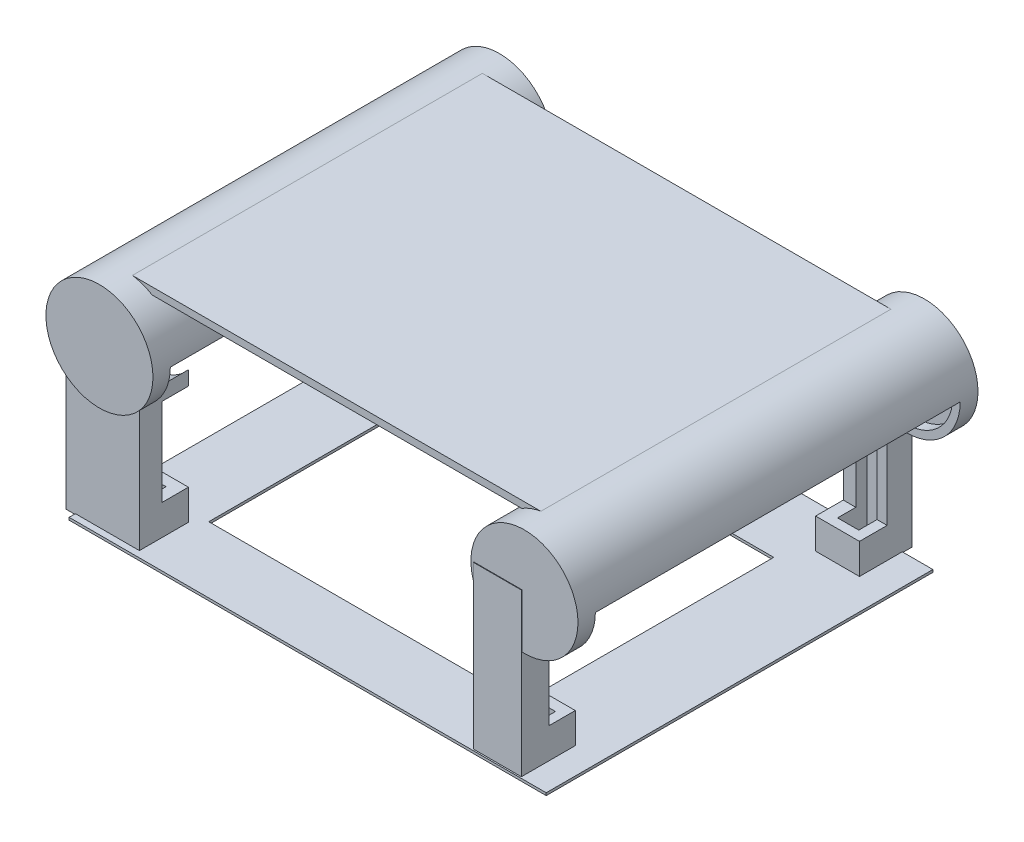
from build123d import *

# Parameters (mm, degrees)
MOTORHOLDERS_DEPTH            = 80
MOTORHOLDERS_DEPTH_BACK       = 80
MOTORHOLDERSSKETCH_R          = 21.41
MOTORHOLDERS_2_DEPTH          = 80
MOTORHOLDERS_2_DEPTH_BACK     = 80
BOSS_EXTRUDE2_DEPTH           = 70
BOSS_EXTRUDE2_DEPTH_BACK      = 70
SKETCH3_W                     = 166.402948119
SKETCH3_H                     = 2.817422897
SKETCH4_W                     = 262.774983374
SKETCH4_H                     = 145.919891702
CUT_EXTRUDE1_DEPTH            = 23
POWERBANKHOLDERS_DEPTH        = 30
POWERBANKHOLDERS_DEPTH_BACK   = 35
SKETCH6_W                     = 31.079303629
SKETCH6_H                     = 22.639087533
SKETCH6_W_2                   = 22.69689808
SKETCH6_H_2                   = 11.734008709
POWERBANKHOLDERS_2_DEPTH      = 30
POWERBANKHOLDERS_2_DEPTH_BACK = 35
SKETCH6_W_3                   = 29.43379696
SKETCH6_H_3                   = 19.610970688
SKETCH6_W_4                   = 20.089976669
SKETCH6_H_4                   = 9.83070569
POWERBANKHOLDERS_3_DEPTH      = 30
POWERBANKHOLDERS_3_DEPTH_BACK = 35
SKETCH6_W_5                   = 17.542642612
SKETCH6_H_5                   = 21.099390751
SKETCH6_W_6                   = 8.482440028
POWERBANKHOLDERS_4_DEPTH      = 30
POWERBANKHOLDERS_4_DEPTH_BACK = 35
SKETCH6_W_7                   = 19.167029737
SKETCH6_H_6                   = 21.547747601
SKETCH6_W_8                   = 10.64703133
SKETCH7_W                     = 190.824703485
SKETCH7_H                     = 154.667210728
SKETCH7_W_2                   = 125.335149465
SKETCH7_H_2                   = 100.638457321
TOPCELLPHONECOVER_DEPTH       = 1
POWERBANKEXTRUDE_DEPTH        = 17.5
POWERBANKEXTRUDE_DEPTH_BACK   = 17.5
SKETCH9_W                     = 243.146360692
SKETCH9_H                     = 137
MOTORHOLDEREXTRUDE_DEPTH      = 77
MOTORHOLDEREXTRUDE_DEPTH_BACK = 77
MOTORHOLDEREXTRUDESKETCH_R    = 18.415


with BuildPart() as part:
    # MotorHoldersSketch → MotorHolders (new, two sides: drawn at the far end of the back side and taken through both)
    with BuildSketch(Plane.XY.offset(-MOTORHOLDERS_DEPTH_BACK)):
        Circle(MOTORHOLDERSSKETCH_R)
    extrude(amount=MOTORHOLDERS_DEPTH + MOTORHOLDERS_DEPTH_BACK)


with BuildPart() as body_2:
    # MotorHoldersSketch → MotorHolders 2 (new, two sides: drawn at the far end of the back side and taken through both)
    with BuildSketch(Plane.XY.offset(-MOTORHOLDERS_2_DEPTH_BACK)):
        with Locations((170, 0)):
            Circle(MOTORHOLDERSSKETCH_R)
    extrude(amount=MOTORHOLDERS_2_DEPTH + MOTORHOLDERS_2_DEPTH_BACK)

    # Sketch3 → Boss-Extrude2 (add, two sides: drawn at the far end of the back side and taken through both)
    with BuildSketch(Plane.XY.offset(-BOSS_EXTRUDE2_DEPTH_BACK)):
        with Locations((85.14207121, 19.724241304)):
            Rectangle(SKETCH3_W, SKETCH3_H)
    extrude(amount=BOSS_EXTRUDE2_DEPTH + BOSS_EXTRUDE2_DEPTH_BACK)


with BuildPart() as cut_extrude1_tool:
    # Sketch4 → Cut-Extrude1 (new body)
    with BuildSketch(Plane(origin=(0, 0, 0), x_dir=(1, 0, 0), z_dir=(0, 1, 0))):
        with Locations((89.893628689, -0.090874356)):
            Rectangle(SKETCH4_W, SKETCH4_H)
    extrude(amount=-CUT_EXTRUDE1_DEPTH)


with BuildPart() as part_1:
    add(part.part)

    # Cut-Extrude1: cut by cut_extrude1_tool
    add(cut_extrude1_tool.part, mode=Mode.SUBTRACT)


with BuildPart() as body_2_1:
    add(body_2.part)

    # Cut-Extrude1: cut by cut_extrude1_tool
    add(cut_extrude1_tool.part, mode=Mode.SUBTRACT)


with BuildPart() as body_3:
    # Sketch6 → PowerBankHolders (new, two sides: drawn at the far end of the back side and taken through both)
    with BuildSketch(Plane(origin=(170, -34.829272125, 0), x_dir=(-1, 0, 0), z_dir=(0, -1, 0)).offset(-POWERBANKHOLDERS_DEPTH_BACK)):
        with Locations((170.111379473, 67.629448186)):
            Rectangle(SKETCH6_W, SKETCH6_H)
        with Locations((169.118096408, 66.379140187)):
            Rectangle(SKETCH6_W_2, SKETCH6_H_2, mode=Mode.SUBTRACT)
    extrude(amount=POWERBANKHOLDERS_DEPTH + POWERBANKHOLDERS_DEPTH_BACK)



with BuildPart() as body_4:
    # Sketch6 → PowerBankHolders 2 (new, two sides: drawn at the far end of the back side and taken through both)
    with BuildSketch(Plane(origin=(170, -34.829272125, 0), x_dir=(-1, 0, 0), z_dir=(0, -1, 0)).offset(-POWERBANKHOLDERS_2_DEPTH_BACK)):
        with Locations((170.443627243, -68.476666678)):
            Rectangle(SKETCH6_W_3, SKETCH6_H_3)
        with Locations((170.421557114, -67.894738702)):
            Rectangle(SKETCH6_W_4, SKETCH6_H_4, mode=Mode.SUBTRACT)
    extrude(amount=POWERBANKHOLDERS_2_DEPTH + POWERBANKHOLDERS_2_DEPTH_BACK)


with BuildPart() as body_5:
    # Sketch6 → PowerBankHolders 3 (new, two sides: drawn at the far end of the back side and taken through both)
    with BuildSketch(Plane(origin=(170, -34.829272125, 0), x_dir=(-1, 0, 0), z_dir=(0, -1, 0)).offset(-POWERBANKHOLDERS_3_DEPTH_BACK)):
        with Locations((11.52721305, 67.312978676)):
            Rectangle(SKETCH6_W_5, SKETCH6_H_5)
        with Locations((11.033379358, 66.379140187)):
            Rectangle(SKETCH6_W_6, SKETCH6_H_2, mode=Mode.SUBTRACT)
    extrude(amount=POWERBANKHOLDERS_3_DEPTH + POWERBANKHOLDERS_3_DEPTH_BACK)


with BuildPart() as body_6:
    # Sketch6 → PowerBankHolders 4 (new, two sides: drawn at the far end of the back side and taken through both)
    with BuildSketch(Plane(origin=(170, -34.829272125, 0), x_dir=(-1, 0, 0), z_dir=(0, -1, 0)).offset(-POWERBANKHOLDERS_4_DEPTH_BACK)):
        with Locations((10.584217292, -69.445055135)):
            Rectangle(SKETCH6_W_7, SKETCH6_H_6)
        with Locations((9.951083707, -67.894738702)):
            Rectangle(SKETCH6_W_8, SKETCH6_H_4, mode=Mode.SUBTRACT)
    extrude(amount=POWERBANKHOLDERS_4_DEPTH + POWERBANKHOLDERS_4_DEPTH_BACK)


with BuildPart() as body_3_1:
    add(body_3.part)

    add(body_4.part)  # TopCellPhoneCover merges body 4

    add(body_5.part)  # TopCellPhoneCover merges body 5

    add(body_6.part)  # TopCellPhoneCover merges body 6
    # Sketch7 → TopCellPhoneCover (add)
    with BuildSketch(Plane(origin=(170, -64.5, 0), x_dir=(-1, 0, 0), z_dir=(0, -1, 0))):
        with Locations((85.907620295, -3.467393964)):
            Rectangle(SKETCH7_W, SKETCH7_H)
        with Locations((89.203645692, -4.077931617)):
            Rectangle(SKETCH7_W_2, SKETCH7_H_2, mode=Mode.SUBTRACT)
    extrude(amount=TOPCELLPHONECOVER_DEPTH)

    # Sketch9 → PowerBankExtrude (cut, two sides: drawn at the far end of the back side and taken through both)
    with BuildSketch(Plane(origin=(170, -34.829272125, 0), x_dir=(-1, 0, 0), z_dir=(0, -1, 0)).offset(-POWERBANKEXTRUDE_DEPTH_BACK)):
        with Locations((61.591374201, -0.682586328)):
            Rectangle(SKETCH9_W, SKETCH9_H)
    extrude(amount=POWERBANKEXTRUDE_DEPTH + POWERBANKEXTRUDE_DEPTH_BACK, mode=Mode.SUBTRACT)


with BuildPart() as motorholderextrude_tool:
    # MotorHolderExtrudeSketch → MotorHolderExtrude (new, two sides: drawn at the far end of the back side and taken through both)
    with BuildSketch(Plane.XY.offset(-MOTORHOLDEREXTRUDE_DEPTH_BACK)):
        with Locations((170, 0)):
            Circle(MOTORHOLDEREXTRUDESKETCH_R)
        Circle(MOTORHOLDEREXTRUDESKETCH_R)
    extrude(amount=MOTORHOLDEREXTRUDE_DEPTH + MOTORHOLDEREXTRUDE_DEPTH_BACK)


with BuildPart() as part_2:
    add(part_1.part)

    # MotorHolderExtrude: cut by motorholderextrude_tool
    add(motorholderextrude_tool.part, mode=Mode.SUBTRACT)


with BuildPart() as body_2_2:
    add(body_2_1.part)

    # MotorHolderExtrude: cut by motorholderextrude_tool
    add(motorholderextrude_tool.part, mode=Mode.SUBTRACT)


with BuildPart() as body_3_2:
    add(body_3_1.part)

    # MotorHolderExtrude: cut by motorholderextrude_tool
    add(motorholderextrude_tool.part, mode=Mode.SUBTRACT)


solid = Compound([part_2.part, body_2_2.part, body_3_2.part])
